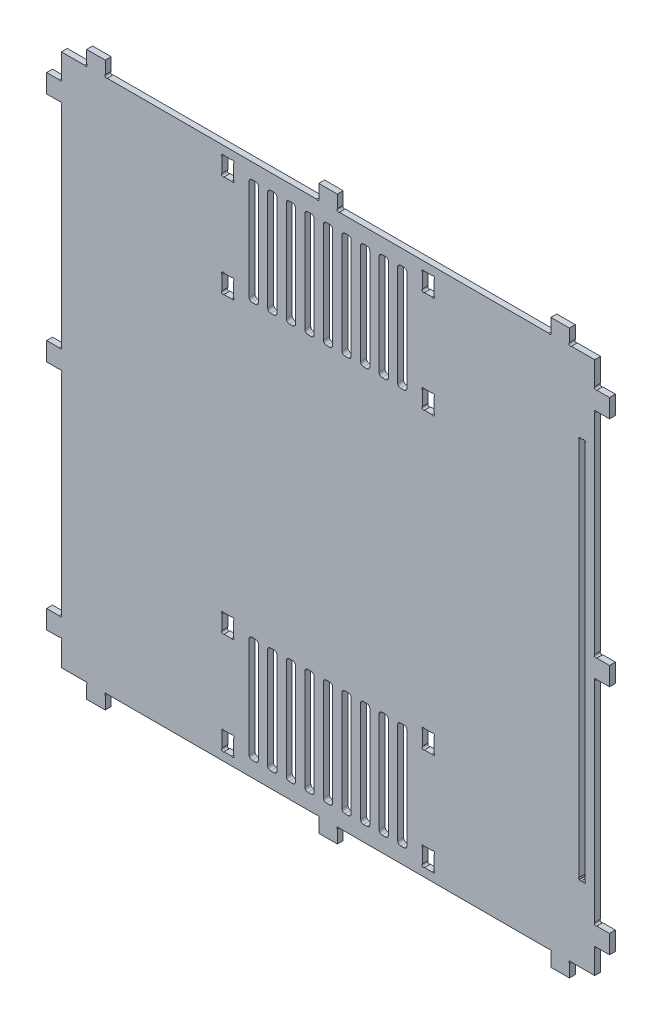
from build123d import *

# Parameters (mm, degrees)
BOSS_EXTRUDE1_DEPTH = 3.175
SKETCH2_W           = 3.302
SKETCH2_H           = 206.35
CUT_EXTRUDE1_DEPTH  = 418.540948216


# Read off the part's stored shape, not the designer's step: Boss-Extrude1
with BuildPart() as part:
    # Boss-Extrude1 outline → Boss-Extrude1 (new body)
    with BuildSketch(Plane.XY):
        with BuildLine():
            Line((13.65, 295.2375), (13.65, 288.422532015))
            ThreePointArc((13.65, 288.422532015), (13.65, 287.3), (12.527467985, 287.3))
            Line((12.527467985, 287.3), (0, 287.3))
            Line((0, 287.3), (0, 274.772532015))
            ThreePointArc((0, 274.772532015), (0, 273.65), (-1.122532015, 273.65))
            Line((-1.122532015, 273.65), (-7.9375, 273.65))
            Line((-7.9375, 273.65), (-7.9375, 263.65))
            Line((-7.9375, 263.65), (-1.122532015, 263.65))
            ThreePointArc((-1.122532015, 263.65), (0, 263.65), (0, 262.527467985))
            Line((0, 262.527467985), (0, 149.772532015))
            ThreePointArc((0, 149.772532015), (0, 148.65), (-1.122532015, 148.65))
            Line((-1.122532015, 148.65), (-7.9375, 148.65))
            Line((-7.9375, 148.65), (-7.9375, 138.65))
            Line((-7.9375, 138.65), (-1.122532015, 138.65))
            ThreePointArc((-1.122532015, 138.65), (0, 138.65), (0, 137.527467985))
            Line((0, 137.527467985), (0, 24.772532015))
            ThreePointArc((0, 24.772532015), (0, 23.65), (-1.122532015, 23.65))
            Line((-1.122532015, 23.65), (-7.9375, 23.65))
            Line((-7.9375, 23.65), (-7.9375, 13.65))
            Line((-7.9375, 13.65), (-1.122532015, 13.65))
            ThreePointArc((-1.122532015, 13.65), (0, 13.65), (0, 12.527467985))
            Line((0, 12.527467985), (0, 0))
            Line((0, 0), (12.527467985, 0))
            ThreePointArc((12.527467985, 0), (13.65, 0), (13.65, -1.122532015))
            Line((13.65, -1.122532015), (13.65, -7.9375))
            Line((13.65, -7.9375), (23.65, -7.9375))
            Line((23.65, -7.9375), (23.65, -1.122532015))
            ThreePointArc((23.65, -1.122532015), (23.65, 0), (24.772532015, 0))
            Line((24.772532015, 0), (137.527467985, 0))
            ThreePointArc((137.527467985, 0), (138.65, 0), (138.65, -1.122532015))
            Line((138.65, -1.122532015), (138.65, -7.9375))
            Line((138.65, -7.9375), (148.65, -7.9375))
            Line((148.65, -7.9375), (148.65, -1.122532015))
            ThreePointArc((148.65, -1.122532015), (148.65, 0), (149.772532015, 0))
            Line((149.772532015, 0), (262.527467985, 0))
            ThreePointArc((262.527467985, 0), (263.65, 0), (263.65, -1.122532015))
            Line((263.65, -1.122532015), (263.65, -7.9375))
            Line((263.65, -7.9375), (273.65, -7.9375))
            Line((273.65, -7.9375), (273.65, -1.122532015))
            ThreePointArc((273.65, -1.122532015), (273.65, 0), (274.772532015, 0))
            Line((274.772532015, 0), (287.3, 0))
            Line((287.3, 0), (287.3, 12.527467985))
            ThreePointArc((287.3, 12.527467985), (287.3, 13.65), (288.422532015, 13.65))
            Line((288.422532015, 13.65), (295.2375, 13.65))
            Line((295.2375, 13.65), (295.2375, 23.65))
            Line((295.2375, 23.65), (288.422532015, 23.65))
            ThreePointArc((288.422532015, 23.65), (287.3, 23.65), (287.3, 24.772532015))
            Line((287.3, 24.772532015), (287.3, 137.527467985))
            ThreePointArc((287.3, 137.527467985), (287.3, 138.65), (288.422532015, 138.65))
            Line((288.422532015, 138.65), (295.2375, 138.65))
            Line((295.2375, 138.65), (295.2375, 148.65))
            Line((295.2375, 148.65), (288.422532015, 148.65))
            ThreePointArc((288.422532015, 148.65), (287.3, 148.65), (287.3, 149.772532015))
            Line((287.3, 149.772532015), (287.3, 262.527467985))
            ThreePointArc((287.3, 262.527467985), (287.3, 263.65), (288.422532015, 263.65))
            Line((288.422532015, 263.65), (295.2375, 263.65))
            Line((295.2375, 263.65), (295.2375, 273.65))
            Line((295.2375, 273.65), (288.422532015, 273.65))
            ThreePointArc((288.422532015, 273.65), (287.3, 273.65), (287.3, 274.772532015))
            Line((287.3, 274.772532015), (287.3, 287.3))
            Line((287.3, 287.3), (274.772532015, 287.3))
            ThreePointArc((274.772532015, 287.3), (273.65, 287.3), (273.65, 288.422532015))
            Line((273.65, 288.422532015), (273.65, 295.2375))
            Line((273.65, 295.2375), (263.65, 295.2375))
            Line((263.65, 295.2375), (263.65, 288.422532015))
            ThreePointArc((263.65, 288.422532015), (263.65, 287.3), (262.527467985, 287.3))
            Line((262.527467985, 287.3), (149.772532015, 287.3))
            ThreePointArc((149.772532015, 287.3), (148.65, 287.3), (148.65, 288.422532015))
            Line((148.65, 288.422532015), (148.65, 295.2375))
            Line((148.65, 295.2375), (138.65, 295.2375))
            Line((138.65, 295.2375), (138.65, 288.422532015))
            ThreePointArc((138.65, 288.422532015), (138.65, 287.3), (137.527467985, 287.3))
            Line((137.527467985, 287.3), (24.772532015, 287.3))
            ThreePointArc((24.772532015, 287.3), (23.65, 287.3), (23.65, 288.422532015))
            Line((23.65, 288.422532015), (23.65, 295.2375))
            Line((23.65, 295.2375), (13.65, 295.2375))
        make_face()
        with BuildLine():
            Line((92.836997861, 13.451559456), (92.836997861, 5.696623486))
            ThreePointArc((92.836997861, 5.696623486), (92.836997861, 4.574091471), (91.714465846, 4.574091471))
            Line((91.714465846, 4.574091471), (87.609529876, 4.574091471))
            ThreePointArc((87.609529876, 4.574091471), (86.486997861, 4.574091471), (86.486997861, 5.696623486))
            Line((86.486997861, 5.696623486), (86.486997861, 13.451559456))
            ThreePointArc((86.486997861, 13.451559456), (86.486997861, 14.574091471), (87.609529876, 14.574091471))
            Line((87.609529876, 14.574091471), (91.714465846, 14.574091471))
            ThreePointArc((91.714465846, 14.574091471), (92.836997861, 14.574091471), (92.836997861, 13.451559456))
        make_face(mode=Mode.SUBTRACT)
        with BuildLine():
            Line((104.549498838, 8.25090853), (102.724498838, 8.25090853))
            ThreePointArc((102.724498838, 8.25090853), (101.601966823, 8.715876514), (101.136998838, 9.83840853))
            Line((101.136998838, 9.83840853), (101.136998838, 63.97740853))
            ThreePointArc((101.136998838, 63.97740853), (101.601966823, 65.099940546), (102.724498838, 65.56490853))
            Line((102.724498838, 65.56490853), (104.549498838, 65.56490853))
            ThreePointArc((104.549498838, 65.56490853), (105.672030853, 65.099940545), (106.136998838, 63.97740853))
            Line((106.136998838, 63.97740853), (106.136998838, 9.83840853))
            ThreePointArc((106.136998838, 9.83840853), (105.672030853, 8.715876515), (104.549498838, 8.25090853))
        make_face(mode=Mode.SUBTRACT)
        with BuildLine():
            Line((91.714465846, 59.438091471), (87.609529876, 59.438091471))
            ThreePointArc((87.609529876, 59.438091471), (86.486997861, 59.438091471), (86.486997861, 60.560623486))
            Line((86.486997861, 60.560623486), (86.486997861, 68.315559456))
            ThreePointArc((86.486997861, 68.315559456), (86.486997861, 69.438091471), (87.609529876, 69.438091471))
            Line((87.609529876, 69.438091471), (91.714465846, 69.438091471))
            ThreePointArc((91.714465846, 69.438091471), (92.836997861, 69.438091471), (92.836997861, 68.315559456))
            Line((92.836997861, 68.315559456), (92.836997861, 60.560623486))
            ThreePointArc((92.836997861, 60.560623486), (92.836997861, 59.438091471), (91.714465846, 59.438091471))
        make_face(mode=Mode.SUBTRACT)
        with BuildLine():
            Line((114.549498838, 8.25090853), (112.724498838, 8.25090853))
            ThreePointArc((112.724498838, 8.25090853), (111.601966823, 8.715876514), (111.136998838, 9.83840853))
            Line((111.136998838, 9.83840853), (111.136998838, 63.97740853))
            ThreePointArc((111.136998838, 63.97740853), (111.601966823, 65.099940546), (112.724498838, 65.56490853))
            Line((112.724498838, 65.56490853), (114.549498838, 65.56490853))
            ThreePointArc((114.549498838, 65.56490853), (115.672030853, 65.099940545), (116.136998838, 63.97740853))
            Line((116.136998838, 63.97740853), (116.136998838, 9.83840853))
            ThreePointArc((116.136998838, 9.83840853), (115.672030853, 8.715876515), (114.549498838, 8.25090853))
        make_face(mode=Mode.SUBTRACT)
        with BuildLine():
            Line((124.549498838, 8.25090853), (122.724498838, 8.25090853))
            ThreePointArc((122.724498838, 8.25090853), (121.601966823, 8.715876514), (121.136998838, 9.83840853))
            Line((121.136998838, 9.83840853), (121.136998838, 63.97740853))
            ThreePointArc((121.136998838, 63.97740853), (121.601966823, 65.099940546), (122.724498838, 65.56490853))
            Line((122.724498838, 65.56490853), (124.549498838, 65.56490853))
            ThreePointArc((124.549498838, 65.56490853), (125.672030853, 65.099940545), (126.136998838, 63.97740853))
            Line((126.136998838, 63.97740853), (126.136998838, 9.83840853))
            ThreePointArc((126.136998838, 9.83840853), (125.672030853, 8.715876515), (124.549498838, 8.25090853))
        make_face(mode=Mode.SUBTRACT)
        with BuildLine():
            Line((131.136998838, 9.83840853), (131.136998838, 63.97740853))
            ThreePointArc((131.136998838, 63.97740853), (131.601966823, 65.099940545), (132.724498838, 65.56490853))
            Line((132.724498838, 65.56490853), (134.549498838, 65.56490853))
            ThreePointArc((134.549498838, 65.56490853), (135.672030853, 65.099940545), (136.136998838, 63.97740853))
            Line((136.136998838, 63.97740853), (136.136998838, 9.83840853))
            ThreePointArc((136.136998838, 9.83840853), (135.672030853, 8.715876515), (134.549498838, 8.25090853))
            Line((134.549498838, 8.25090853), (132.724498838, 8.25090853))
            ThreePointArc((132.724498838, 8.25090853), (131.601966823, 8.715876515), (131.136998838, 9.83840853))
        make_face(mode=Mode.SUBTRACT)
        with BuildLine():
            Line((144.549498838, 8.25090853), (142.724498838, 8.25090853))
            ThreePointArc((142.724498838, 8.25090853), (141.601966823, 8.715876515), (141.136998838, 9.83840853))
            Line((141.136998838, 9.83840853), (141.136998838, 63.97740853))
            ThreePointArc((141.136998838, 63.97740853), (141.601966823, 65.099940545), (142.724498838, 65.56490853))
            Line((142.724498838, 65.56490853), (144.549498838, 65.56490853))
            ThreePointArc((144.549498838, 65.56490853), (145.672030853, 65.099940545), (146.136998838, 63.97740853))
            Line((146.136998838, 63.97740853), (146.136998838, 9.83840853))
            ThreePointArc((146.136998838, 9.83840853), (145.672030853, 8.715876515), (144.549498838, 8.25090853))
        make_face(mode=Mode.SUBTRACT)
        with BuildLine():
            Line((194.436999814, 5.666542396), (194.436999814, 13.421478365))
            ThreePointArc((194.436999814, 13.421478365), (194.436999814, 14.54401038), (195.559531829, 14.54401038))
            Line((195.559531829, 14.54401038), (199.664467799, 14.54401038))
            ThreePointArc((199.664467799, 14.54401038), (200.786999814, 14.54401038), (200.786999814, 13.421478365))
            Line((200.786999814, 13.421478365), (200.786999814, 5.666542396))
            ThreePointArc((200.786999814, 5.666542396), (200.786999814, 4.54401038), (199.664467799, 4.54401038))
            Line((199.664467799, 4.54401038), (195.559531829, 4.54401038))
            ThreePointArc((195.559531829, 4.54401038), (194.436999814, 4.54401038), (194.436999814, 5.666542396))
        make_face(mode=Mode.SUBTRACT)
        with BuildLine():
            Line((151.136998838, 9.83840853), (151.136998838, 63.97740853))
            ThreePointArc((151.136998838, 63.97740853), (151.601966823, 65.099940545), (152.724498838, 65.56490853))
            Line((152.724498838, 65.56490853), (154.549498838, 65.56490853))
            ThreePointArc((154.549498838, 65.56490853), (155.672030853, 65.099940545), (156.136998838, 63.97740853))
            Line((156.136998838, 63.97740853), (156.136998838, 9.83840853))
            ThreePointArc((156.136998838, 9.83840853), (155.672030853, 8.715876515), (154.549498838, 8.25090853))
            Line((154.549498838, 8.25090853), (152.724498838, 8.25090853))
            ThreePointArc((152.724498838, 8.25090853), (151.601966823, 8.715876515), (151.136998838, 9.83840853))
        make_face(mode=Mode.SUBTRACT)
        with BuildLine():
            Line((164.549498838, 8.25090853), (162.724498838, 8.25090853))
            ThreePointArc((162.724498838, 8.25090853), (161.601966823, 8.715876515), (161.136998838, 9.83840853))
            Line((161.136998838, 9.83840853), (161.136998838, 63.97740853))
            ThreePointArc((161.136998838, 63.97740853), (161.602585269, 65.100558652), (162.726247588, 65.564907567))
            Line((162.726247588, 65.564907567), (164.549497999, 65.56490853))
            ThreePointArc((164.549497999, 65.56490853), (165.672030556, 65.099940842), (166.136998838, 63.97740853))
            Line((166.136998838, 63.97740853), (166.136998838, 9.83840853))
            ThreePointArc((166.136998838, 9.83840853), (165.672030853, 8.715876515), (164.549498838, 8.25090853))
        make_face(mode=Mode.SUBTRACT)
        with BuildLine():
            Line((171.136998838, 9.83840853), (171.136998838, 63.97740853))
            ThreePointArc((171.136998838, 63.97740853), (171.601966823, 65.099940545), (172.724498838, 65.56490853))
            Line((172.724498838, 65.56490853), (174.549498838, 65.56490853))
            ThreePointArc((174.549498838, 65.56490853), (175.672030853, 65.099940545), (176.136998838, 63.97740853))
            Line((176.136998838, 63.97740853), (176.136998838, 9.83840853))
            ThreePointArc((176.136998838, 9.83840853), (175.672030853, 8.715876515), (174.549498838, 8.25090853))
            Line((174.549498838, 8.25090853), (172.724498838, 8.25090853))
            ThreePointArc((172.724498838, 8.25090853), (171.601966823, 8.715876515), (171.136998838, 9.83840853))
        make_face(mode=Mode.SUBTRACT)
        with BuildLine():
            Line((184.549498838, 8.25090853), (182.724498838, 8.25090853))
            ThreePointArc((182.724498838, 8.25090853), (181.601966823, 8.715876515), (181.136998838, 9.83840853))
            Line((181.136998838, 9.83840853), (181.136998838, 63.97740853))
            ThreePointArc((181.136998838, 63.97740853), (181.601966823, 65.099940545), (182.724498838, 65.56490853))
            Line((182.724498838, 65.56490853), (184.549498838, 65.56490853))
            ThreePointArc((184.549498838, 65.56490853), (185.672030853, 65.099940545), (186.136998838, 63.97740853))
            Line((186.136998838, 63.97740853), (186.136998838, 9.83840853))
            ThreePointArc((186.136998838, 9.83840853), (185.672030853, 8.715876515), (184.549498838, 8.25090853))
        make_face(mode=Mode.SUBTRACT)
        with BuildLine():
            Line((195.559531829, 69.40801038), (199.664467799, 69.40801038))
            ThreePointArc((199.664467799, 69.40801038), (200.786999814, 69.40801038), (200.786999814, 68.285478365))
            Line((200.786999814, 68.285478365), (200.786999814, 60.530542396))
            ThreePointArc((200.786999814, 60.530542396), (200.786999814, 59.40801038), (199.664467799, 59.40801038))
            Line((199.664467799, 59.40801038), (195.559531829, 59.40801038))
            ThreePointArc((195.559531829, 59.40801038), (194.436999814, 59.40801038), (194.436999814, 60.530542396))
            Line((194.436999814, 60.530542396), (194.436999814, 68.285478365))
            ThreePointArc((194.436999814, 68.285478365), (194.436999814, 69.40801038), (195.559531829, 69.40801038))
        make_face(mode=Mode.SUBTRACT)
        with BuildLine():
            Line((280.930799481, 40.475), (280.000863511, 40.475))
            ThreePointArc((280.000863511, 40.475), (278.878331496, 40.475), (278.878331496, 41.597532015))
            Line((278.878331496, 41.597532015), (278.878331496, 245.702467985))
            ThreePointArc((278.878331496, 245.702467985), (278.878331496, 246.825), (280.000863511, 246.825))
            Line((280.000863511, 246.825), (280.930799481, 246.825))
            ThreePointArc((280.930799481, 246.825), (282.053331496, 246.825), (282.053331496, 245.702467985))
            Line((282.053331496, 245.702467985), (282.053331496, 41.597532015))
            ThreePointArc((282.053331496, 41.597532015), (282.053331496, 40.475), (280.930799481, 40.475))
        make_face(mode=Mode.SUBTRACT)
        with BuildLine():
            Line((86.486997861, 218.984440544), (86.486997861, 226.739376514))
            ThreePointArc((86.486997861, 226.739376514), (86.486997861, 227.861908529), (87.609529876, 227.861908529))
            Line((87.609529876, 227.861908529), (91.714465846, 227.861908529))
            ThreePointArc((91.714465846, 227.861908529), (92.836997861, 227.861908529), (92.836997861, 226.739376514))
            Line((92.836997861, 226.739376514), (92.836997861, 218.984440544))
            ThreePointArc((92.836997861, 218.984440544), (92.836997861, 217.861908529), (91.714465846, 217.861908529))
            Line((91.714465846, 217.861908529), (87.609529876, 217.861908529))
            ThreePointArc((87.609529876, 217.861908529), (86.486997861, 217.861908529), (86.486997861, 218.984440544))
        make_face(mode=Mode.SUBTRACT)
        with BuildLine():
            Line((101.136998838, 223.32259147), (101.136998838, 277.461591202))
            ThreePointArc((101.136998838, 277.461591202), (101.601966806, 278.584123312), (102.724498838, 279.04909147))
            Line((102.724498838, 279.04909147), (104.549498838, 279.04909147))
            ThreePointArc((104.549498838, 279.04909147), (105.672030853, 278.584123485), (106.136998838, 277.46159147))
            Line((106.136998838, 277.46159147), (106.136998838, 223.32259147))
            ThreePointArc((106.136998838, 223.32259147), (105.672030853, 222.200059455), (104.549498838, 221.73509147))
            Line((104.549498838, 221.73509147), (102.724498838, 221.73509147))
            ThreePointArc((102.724498838, 221.73509147), (101.601966823, 222.200059454), (101.136998838, 223.32259147))
        make_face(mode=Mode.SUBTRACT)
        with BuildLine():
            Line((111.136998838, 223.32259147), (111.136998838, 277.46159147))
            ThreePointArc((111.136998838, 277.46159147), (111.601966822, 278.584123486), (112.724498838, 279.04909147))
            Line((112.724498838, 279.04909147), (114.549498838, 279.04909147))
            ThreePointArc((114.549498838, 279.04909147), (115.672030853, 278.584123485), (116.136998838, 277.46159147))
            Line((116.136998838, 277.46159147), (116.136998838, 223.32259147))
            ThreePointArc((116.136998838, 223.32259147), (115.672030853, 222.200059455), (114.549498838, 221.73509147))
            Line((114.549498838, 221.73509147), (112.724498838, 221.73509147))
            ThreePointArc((112.724498838, 221.73509147), (111.601966823, 222.200059454), (111.136998838, 223.32259147))
        make_face(mode=Mode.SUBTRACT)
        with BuildLine():
            Line((121.136998838, 223.32259147), (121.136998838, 277.46159147))
            ThreePointArc((121.136998838, 277.46159147), (121.601966822, 278.584123486), (122.724498838, 279.04909147))
            Line((122.724498838, 279.04909147), (124.549498838, 279.04909147))
            ThreePointArc((124.549498838, 279.04909147), (125.672030853, 278.584123485), (126.136998838, 277.46159147))
            Line((126.136998838, 277.46159147), (126.136998838, 223.32259147))
            ThreePointArc((126.136998838, 223.32259147), (125.672030853, 222.200059455), (124.549498838, 221.73509147))
            Line((124.549498838, 221.73509147), (122.724498838, 221.73509147))
            ThreePointArc((122.724498838, 221.73509147), (121.601966823, 222.200059454), (121.136998838, 223.32259147))
        make_face(mode=Mode.SUBTRACT)
        with BuildLine():
            Line((134.549498838, 221.73509147), (132.724498838, 221.73509147))
            ThreePointArc((132.724498838, 221.73509147), (131.601966823, 222.200059455), (131.136998838, 223.32259147))
            Line((131.136998838, 223.32259147), (131.136998838, 277.46159147))
            ThreePointArc((131.136998838, 277.46159147), (131.601966822, 278.584123486), (132.724498838, 279.04909147))
            Line((132.724498838, 279.04909147), (134.549498838, 279.04909147))
            ThreePointArc((134.549498838, 279.04909147), (135.672030853, 278.584123485), (136.136998838, 277.46159147))
            Line((136.136998838, 277.46159147), (136.136998838, 223.32259147))
            ThreePointArc((136.136998838, 223.32259147), (135.672030853, 222.200059455), (134.549498838, 221.73509147))
        make_face(mode=Mode.SUBTRACT)
        with BuildLine():
            Line((141.136998838, 223.32259147), (141.136998838, 277.46159147))
            ThreePointArc((141.136998838, 277.46159147), (141.601966822, 278.584123486), (142.724498838, 279.04909147))
            Line((142.724498838, 279.04909147), (144.549498838, 279.04909147))
            ThreePointArc((144.549498838, 279.04909147), (145.672030853, 278.584123485), (146.136998838, 277.46159147))
            Line((146.136998838, 277.46159147), (146.136998838, 223.32259147))
            ThreePointArc((146.136998838, 223.32259147), (145.672030853, 222.200059455), (144.549498838, 221.73509147))
            Line((144.549498838, 221.73509147), (142.724498838, 221.73509147))
            ThreePointArc((142.724498838, 221.73509147), (141.601966823, 222.200059455), (141.136998838, 223.32259147))
        make_face(mode=Mode.SUBTRACT)
        with BuildLine():
            Line((87.609529876, 282.725908529), (91.714465846, 282.725908529))
            ThreePointArc((91.714465846, 282.725908529), (92.836997861, 282.725908529), (92.836997861, 281.603376514))
            Line((92.836997861, 281.603376514), (92.836997861, 273.848440544))
            ThreePointArc((92.836997861, 273.848440544), (92.836997861, 272.725908529), (91.714465846, 272.725908529))
            Line((91.714465846, 272.725908529), (87.609529876, 272.725908529))
            ThreePointArc((87.609529876, 272.725908529), (86.486997861, 272.725908529), (86.486997861, 273.848440544))
            Line((86.486997861, 273.848440544), (86.486997861, 281.603376514))
            ThreePointArc((86.486997861, 281.603376514), (86.486997861, 282.725908529), (87.609529876, 282.725908529))
        make_face(mode=Mode.SUBTRACT)
        with BuildLine():
            Line((154.549498838, 221.73509147), (152.724498838, 221.73509147))
            ThreePointArc((152.724498838, 221.73509147), (151.601966823, 222.200059455), (151.136998838, 223.32259147))
            Line((151.136998838, 223.32259147), (151.136998838, 277.46159147))
            ThreePointArc((151.136998838, 277.46159147), (151.601966822, 278.584123486), (152.724498838, 279.04909147))
            Line((152.724498838, 279.04909147), (154.549498838, 279.04909147))
            ThreePointArc((154.549498838, 279.04909147), (155.672030853, 278.584123485), (156.136998838, 277.46159147))
            Line((156.136998838, 277.46159147), (156.136998838, 223.32259147))
            ThreePointArc((156.136998838, 223.32259147), (155.672030853, 222.200059455), (154.549498838, 221.73509147))
        make_face(mode=Mode.SUBTRACT)
        with BuildLine():
            Line((161.136998838, 223.32259147), (161.136998838, 277.461591202))
            ThreePointArc((161.136998838, 277.461591202), (161.601966806, 278.584123312), (162.724498838, 279.04909147))
            Line((162.724498838, 279.04909147), (164.549498838, 279.04909147))
            ThreePointArc((164.549498838, 279.04909147), (165.672030712, 278.584123144), (166.136998356, 277.461590988))
            Line((166.136998356, 277.461590988), (166.136998356, 223.322590988))
            ThreePointArc((166.136998356, 223.322590988), (165.672030372, 222.200058972), (164.549498356, 221.735090988))
            Line((164.549498356, 221.735090988), (162.724497517, 221.735091952))
            ThreePointArc((162.724497517, 221.735091952), (161.601966385, 222.200060092), (161.136998838, 223.32259147))
        make_face(mode=Mode.SUBTRACT)
        with BuildLine():
            Line((174.549498838, 221.73509147), (172.724498838, 221.73509147))
            ThreePointArc((172.724498838, 221.73509147), (171.601966823, 222.200059455), (171.136998838, 223.32259147))
            Line((171.136998838, 223.32259147), (171.136998838, 277.46159147))
            ThreePointArc((171.136998838, 277.46159147), (171.601966822, 278.584123486), (172.724498838, 279.04909147))
            Line((172.724498838, 279.04909147), (174.549498838, 279.04909147))
            ThreePointArc((174.549498838, 279.04909147), (175.672030853, 278.584123485), (176.136998838, 277.46159147))
            Line((176.136998838, 277.46159147), (176.136998838, 223.32259147))
            ThreePointArc((176.136998838, 223.32259147), (175.672030853, 222.200059455), (174.549498838, 221.73509147))
        make_face(mode=Mode.SUBTRACT)
        with BuildLine():
            Line((200.786999814, 226.769457604), (200.786999814, 219.014521635))
            ThreePointArc((200.786999814, 219.014521635), (200.786999814, 217.89198962), (199.664467799, 217.89198962))
            Line((199.664467799, 217.89198962), (195.559531829, 217.89198962))
            ThreePointArc((195.559531829, 217.89198962), (194.436999814, 217.89198962), (194.436999814, 219.014521635))
            Line((194.436999814, 219.014521635), (194.436999814, 226.769457604))
            ThreePointArc((194.436999814, 226.769457604), (194.436999813, 227.89198962), (195.559531829, 227.89198962))
            Line((195.559531829, 227.89198962), (199.664467799, 227.89198962))
            ThreePointArc((199.664467799, 227.89198962), (200.786999815, 227.89198962), (200.786999814, 226.769457604))
        make_face(mode=Mode.SUBTRACT)
        with BuildLine():
            Line((181.136998838, 223.32259147), (181.136998838, 277.46159147))
            ThreePointArc((181.136998838, 277.46159147), (181.601966822, 278.584123486), (182.724498838, 279.04909147))
            Line((182.724498838, 279.04909147), (184.549498838, 279.04909147))
            ThreePointArc((184.549498838, 279.04909147), (185.672030853, 278.584123485), (186.136998838, 277.46159147))
            Line((186.136998838, 277.46159147), (186.136998838, 223.32259147))
            ThreePointArc((186.136998838, 223.32259147), (185.672030853, 222.200059455), (184.549498838, 221.73509147))
            Line((184.549498838, 221.73509147), (182.724498838, 221.73509147))
            ThreePointArc((182.724498838, 221.73509147), (181.601966823, 222.200059455), (181.136998838, 223.32259147))
        make_face(mode=Mode.SUBTRACT)
        with BuildLine():
            Line((199.664467799, 272.75598962), (195.559531829, 272.75598962))
            ThreePointArc((195.559531829, 272.75598962), (194.436999814, 272.75598962), (194.436999814, 273.878521635))
            Line((194.436999814, 273.878521635), (194.436999814, 281.633457604))
            ThreePointArc((194.436999814, 281.633457604), (194.436999814, 282.755989619), (195.559531829, 282.75598962))
            Line((195.559531829, 282.75598962), (199.664467799, 282.75598962))
            ThreePointArc((199.664467799, 282.75598962), (200.786999814, 282.755989619), (200.786999814, 281.633457604))
            Line((200.786999814, 281.633457604), (200.786999814, 273.878521635))
            ThreePointArc((200.786999814, 273.878521635), (200.786999814, 272.75598962), (199.664467799, 272.75598962))
        make_face(mode=Mode.SUBTRACT)
    extrude(amount=BOSS_EXTRUDE1_DEPTH)

    # Sketch2 → Cut-Extrude1 (cut, through all)
    with BuildSketch(Plane.XY.offset(3.175)):
        with Locations((280.465831496, 143.65)):
            Rectangle(SKETCH2_W, SKETCH2_H)
    extrude(amount=-CUT_EXTRUDE1_DEPTH, mode=Mode.SUBTRACT)


solid = part.part
